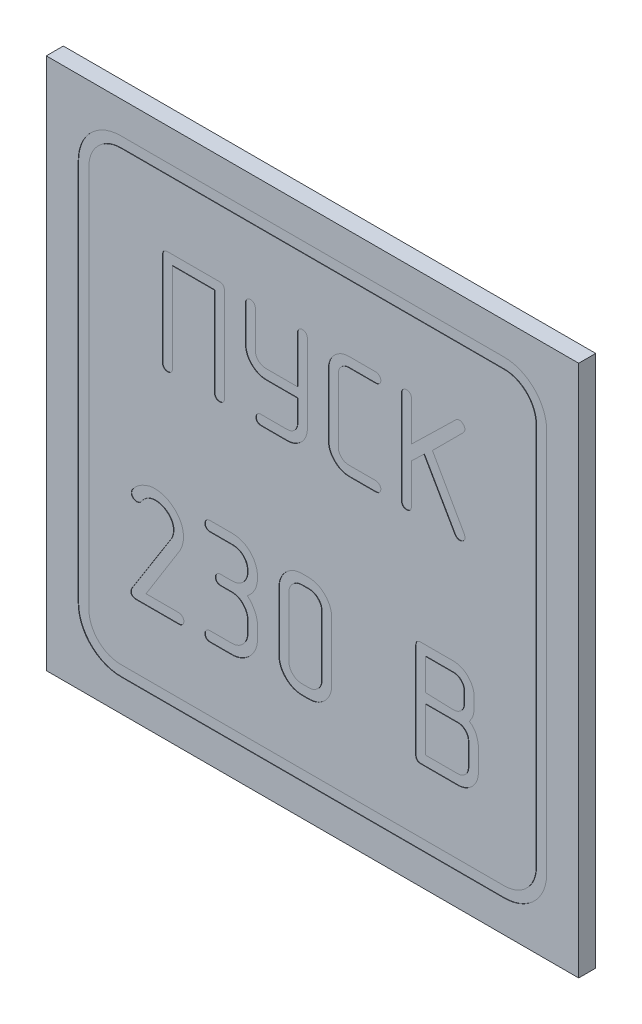
from build123d import *

# Parameters (mm, degrees)
SKETCH_1_W                 = 25
SKETCH_1_H                 = 25
EXTRUDE_1_DEPTH            = 0.8
CUT_EXTRUDE_1_DEPTH        = 0.02
CUT_EXTRUDE_1_2_DEPTH      = 0.02
CUT_EXTRUDE_1_2_DEPTH_BACK = 0.02


with BuildPart() as part:
    # Эскиз1 → Вытянуть1 (new body)
    with BuildSketch(Plane.XY):
        with Locations((12.5, 12.5)):
            Rectangle(SKETCH_1_W, SKETCH_1_H)
    extrude(amount=EXTRUDE_1_DEPTH)

    # Эскиз2 → Cut-Extrude 1 (cut)
    # profile 1 of 8: a face of its own
    with BuildSketch(Plane.XY.offset(0.8)):
        with BuildLine():
            add(Edge.make_bspline(
                [(8.365795812, 15.244391424), (8.365072341, 15.226090597), (8.3636754, 15.190753788), (8.351056124, 15.140751757), (8.330695909, 15.095952852), (8.310030336, 15.071777107), (8.299799816, 15.059808872)],
                knots=[0, 0, 0, 0, 1.091649492, 2.107850678, 3.063288918, 4, 4, 4, 4], degree=3))
            add(Edge.make_bspline(
                [(8.299799816, 15.059808872), (8.288784641, 15.050728173), (8.26682198, 15.032622576), (8.227036995, 15.013721489), (8.182524717, 15.002435695), (8.151034119, 15.000828199), (8.134809825, 15)],
                knots=[0, 0, 0, 0, 0.951182289, 1.896519658, 2.916264364, 4, 4, 4, 4], degree=3))
            add(Edge.make_bspline(
                [(8.134809825, 15), (8.11959959, 15.000786555), (8.090107441, 15.002311658), (8.047588298, 15.014478485), (8.00782008, 15.033025544), (7.971464218, 15.059807151), (7.941137701, 15.095253577), (7.919389365, 15.13876654), (7.905452492, 15.189582778), (7.904388213, 15.22607252), (7.903823838, 15.245422611)],
                knots=[0, 0, 0, 0, 0.960624492, 1.862619603, 2.776848362, 3.724840655, 4.696474829, 5.698056661, 6.779305879, 8, 8, 8, 8], degree=3))
            Line((7.903823838, 15.245422611), (7.903823838, 19.421731753))
            Line((7.903823838, 19.421731753), (5.923943948, 19.421731753))
            Line((5.923943948, 19.421731753), (5.923943948, 15.245422611))
            add(Edge.make_bspline(
                [(5.923943948, 15.245422611), (5.923216357, 15.2271249), (5.921811461, 15.191794106), (5.909247595, 15.141750177), (5.888578086, 15.096847872), (5.868149321, 15.072144714), (5.857947952, 15.059808872)],
                knots=[0, 0, 0, 0, 1.08722023, 2.099298278, 3.050859919, 4, 4, 4, 4], degree=3))
            add(Edge.make_bspline(
                [(5.857947952, 15.059808872), (5.846932778, 15.050728173), (5.824970116, 15.032622576), (5.785185131, 15.013721489), (5.740672854, 15.002435695), (5.709182255, 15.000828199), (5.692957961, 15)],
                knots=[0, 0, 0, 0, 0.951182289, 1.896519658, 2.916264364, 4, 4, 4, 4], degree=3))
            add(Edge.make_bspline(
                [(5.692957961, 15), (5.677746708, 15.000785682), (5.648252583, 15.002309093), (5.605747628, 15.014488075), (5.565924848, 15.032988387), (5.529992317, 15.059796655), (5.498957884, 15.094276289), (5.477599734, 15.137788547), (5.463582149, 15.188535795), (5.462529945, 15.225035859), (5.461971974, 15.244391424)],
                knots=[0, 0, 0, 0, 0.962602444, 1.866454789, 2.78256597, 3.732510206, 4.689672778, 5.693316895, 6.776792436, 8, 8, 8, 8], degree=3))
            Line((5.461971974, 15.244391424), (5.461971974, 19.639312304))
            add(Edge.make_bspline(
                [(5.461971974, 19.639312304), (5.4627342, 19.658623225), (5.464164995, 19.694872288), (5.475363616, 19.745279174), (5.494288385, 19.788359044), (5.521276856, 19.823974879), (5.556423668, 19.851668459), (5.599399936, 19.870259857), (5.649424763, 19.881449447), (5.685332337, 19.882924506), (5.704301023, 19.883703727)],
                knots=[0, 0, 0, 0, 1.174787525, 2.205226063, 3.123069814, 4.018700482, 4.897801082, 5.815644833, 6.846083372, 8, 8, 8, 8], degree=3))
            Line((5.704301023, 19.883703727), (8.123466763, 19.883703727))
            add(Edge.make_bspline(
                [(8.123466763, 19.883703727), (8.142435449, 19.882924506), (8.178343023, 19.881449447), (8.22836785, 19.870259857), (8.271344118, 19.851668459), (8.30649093, 19.823974879), (8.333479402, 19.788359044), (8.35240417, 19.745279174), (8.363602791, 19.694872288), (8.365033586, 19.658623225), (8.365795812, 19.639312304)],
                knots=[0, 0, 0, 0, 1.153916628, 2.184355167, 3.102198918, 3.981299518, 4.876930186, 5.794773937, 6.825212475, 8, 8, 8, 8], degree=3))
            Line((8.365795812, 19.639312304), (8.365795812, 15.244391424))
        make_face()
    # profile 2 of 8: a face of its own
    with BuildSketch(Plane.XY.offset(0.8)):
        with BuildLine():
            Line((11.797587621, 16.979879889), (10.332270265, 16.979879889))
            add(Edge.make_bspline(
                [(10.332270265, 16.979879889), (10.299561949, 16.980536984), (10.235232436, 16.981829335), (10.140712119, 16.996106711), (10.049359977, 17.017357149), (9.961236333, 17.048593294), (9.87668915, 17.088885209), (9.79577052, 17.137913299), (9.717844992, 17.194869915), (9.644585923, 17.260396467), (9.576833048, 17.331764213), (9.517529717, 17.408364815), (9.468325093, 17.489344358), (9.425984585, 17.572940189), (9.395458231, 17.661634457), (9.372863727, 17.753773675), (9.35750013, 17.849692224), (9.356328064, 17.915107241), (9.355735757, 17.948164898)],
                knots=[0, 0, 0, 0, 1.026333242, 2.018554473, 2.995093272, 3.968046237, 4.948157751, 5.931118087, 6.935012911, 7.974823293, 9.013288221, 10.021525797, 11.010100225, 11.985206272, 12.958159238, 13.947734932, 14.962882269, 16, 16, 16, 16], degree=3))
            Line((9.355735757, 17.948164898), (9.355735757, 19.641374678))
            add(Edge.make_bspline(
                [(9.355735757, 19.641374678), (9.356446916, 19.657289295), (9.357879499, 19.689348272), (9.372286892, 19.736000625), (9.393880118, 19.781164952), (9.414345703, 19.808060395), (9.424825316, 19.821832481)],
                knots=[0, 0, 0, 0, 0.966544804, 1.947042782, 2.94876229, 4, 4, 4, 4], degree=3))
            add(Edge.make_bspline(
                [(9.424825316, 19.821832481), (9.436551063, 19.831222703), (9.459702648, 19.849762975), (9.499293033, 19.869382361), (9.542035733, 19.881339108), (9.57151708, 19.882899152), (9.586721744, 19.883703727)],
                knots=[0, 0, 0, 0, 1.015427485, 2.004883423, 2.971041728, 4, 4, 4, 4], degree=3))
            add(Edge.make_bspline(
                [(9.586721744, 19.883703727), (9.601229667, 19.882846225), (9.630003048, 19.881145552), (9.671670288, 19.869500591), (9.711001724, 19.85012768), (9.747620356, 19.824028887), (9.779570148, 19.789488257), (9.802297619, 19.746195792), (9.81602051, 19.695130811), (9.817123061, 19.658655005), (9.817707731, 19.639312304)],
                knots=[0, 0, 0, 0, 0.921612733, 1.827822837, 2.726630868, 3.696675955, 4.670893298, 5.687299756, 6.773601616, 8, 8, 8, 8], degree=3))
            Line((9.817707731, 19.639312304), (9.817707731, 17.930634711))
            add(Edge.make_bspline(
                [(9.817707731, 17.930634711), (9.81957956, 17.897465328), (9.823246025, 17.832494456), (9.849583401, 17.738906707), (9.894445397, 17.653195085), (9.937255124, 17.605345239), (9.958980411, 17.581062168)],
                knots=[0, 0, 0, 0, 1.028312002, 2.014216694, 2.992245141, 4, 4, 4, 4], degree=3))
            add(Edge.make_bspline(
                [(9.958980411, 17.581062168), (9.984208148, 17.560970098), (10.033940572, 17.521361814), (10.090107911, 17.491584453), (10.117783277, 17.476912237)],
                knots=[0, 0, 0, 0, 1.01453881, 2, 2, 2, 2], degree=3))
            add(Edge.make_bspline(
                [(10.117783277, 17.476912237), (10.151575415, 17.46696657), (10.215301227, 17.448210855), (10.281556076, 17.443884204), (10.312677703, 17.441851864)],
                knots=[0, 0, 0, 0, 1.06054792, 2, 2, 2, 2], degree=3))
            Line((10.312677703, 17.441851864), (11.797587621, 17.441851864))
            Line((11.797587621, 17.441851864), (11.797587621, 19.639312304))
            add(Edge.make_bspline(
                [(11.797587621, 19.639312304), (11.798269717, 19.65557461), (11.799629141, 19.687985538), (11.814138843, 19.734969869), (11.835731958, 19.78013365), (11.856197559, 19.807029168), (11.866677179, 19.820801293)],
                knots=[0, 0, 0, 0, 0.982279067, 1.957691288, 2.954214966, 4, 4, 4, 4], degree=3))
            add(Edge.make_bspline(
                [(11.866677179, 19.820801293), (11.878351303, 19.83060446), (11.901245628, 19.849829618), (11.941175864, 19.869341734), (11.983879347, 19.88134993), (12.013366137, 19.882902835), (12.028573608, 19.883703727)],
                knots=[0, 0, 0, 0, 1.025879868, 2.011870596, 2.974645281, 4, 4, 4, 4], degree=3))
            add(Edge.make_bspline(
                [(12.028573608, 19.883703727), (12.043081531, 19.882846225), (12.071854912, 19.881145552), (12.113522151, 19.869500591), (12.152853588, 19.85012768), (12.189472219, 19.824028887), (12.221422012, 19.789488257), (12.244149483, 19.746195792), (12.257872374, 19.695130811), (12.258974925, 19.658655005), (12.259559595, 19.639312304)],
                knots=[0, 0, 0, 0, 0.921612733, 1.827822837, 2.726630868, 3.696675955, 4.670893298, 5.687299756, 6.773601616, 8, 8, 8, 8], degree=3))
            Line((12.259559595, 19.639312304), (12.259559595, 15.976534508))
            add(Edge.make_bspline(
                [(12.259559595, 15.976534508), (12.258866121, 15.943491165), (12.257502049, 15.878494431), (12.243777212, 15.783081777), (12.220797065, 15.691687544), (12.189648367, 15.60369989), (12.150610941, 15.518174862), (12.100664119, 15.437117659), (12.042734514, 15.359416428), (11.977012, 15.28670978), (11.905296766, 15.22004835), (11.828995818, 15.16084003), (11.748348184, 15.111217203), (11.664179404, 15.071010319), (11.576769563, 15.038172672), (11.485002519, 15.016026359), (11.389670148, 15.002056061), (11.325009378, 15.000690608), (11.292305774, 15)],
                knots=[0, 0, 0, 0, 1.037699588, 2.041170104, 3.02081998, 3.994318803, 4.970390255, 5.968733261, 6.979615547, 8.011962211, 9.04363074, 10.05243397, 11.041563021, 12.012482399, 12.979489555, 13.969620435, 14.973090951, 16, 16, 16, 16], degree=3))
            Line((11.292305774, 15), (10.083754091, 15))
            add(Edge.make_bspline(
                [(10.083754091, 15), (10.066135917, 15.00071367), (10.032145308, 15.002090547), (9.983880657, 15.014900494), (9.940279773, 15.035385523), (9.916310615, 15.055793323), (9.904327476, 15.065995996)],
                knots=[0, 0, 0, 0, 1.077429077, 2.078675667, 3.03945327, 4, 4, 4, 4], degree=3))
            add(Edge.make_bspline(
                [(9.904327476, 15.065995996), (9.894901818, 15.077703459), (9.876097724, 15.101059731), (9.856799424, 15.141554301), (9.844815823, 15.185278527), (9.843258914, 15.215437264), (9.84245623, 15.230985987)],
                knots=[0, 0, 0, 0, 0.998808508, 1.992613065, 2.965065947, 4, 4, 4, 4], degree=3))
            add(Edge.make_bspline(
                [(9.84245623, 15.230985987), (9.843192511, 15.244850202), (9.844658667, 15.272457997), (9.85853213, 15.312623366), (9.877712528, 15.352111969), (9.905972226, 15.389186574), (9.940726212, 15.422127061), (9.984195967, 15.445294946), (10.03324552, 15.460450605), (10.068507554, 15.461451434), (10.086847654, 15.461971974)],
                knots=[0, 0, 0, 0, 0.886426588, 1.765140182, 2.701969987, 3.694250836, 4.73997423, 5.746606742, 6.827989987, 8, 8, 8, 8], degree=3))
            Line((10.086847654, 15.461971974), (11.308804773, 15.461971974))
            add(Edge.make_bspline(
                [(11.308804773, 15.461971974), (11.341265925, 15.463891509), (11.405174953, 15.46767066), (11.49769862, 15.493617479), (11.581382591, 15.539683269), (11.657068822, 15.60028657), (11.719645384, 15.675905931), (11.765156106, 15.764133002), (11.792530282, 15.862867149), (11.795864091, 15.932358838), (11.797587621, 15.968285008)],
                knots=[0, 0, 0, 0, 0.991527422, 1.952104304, 2.905769643, 3.891330169, 4.898304592, 5.879829594, 6.903903422, 8, 8, 8, 8], degree=3))
            Line((11.797587621, 15.968285008), (11.797587621, 16.979879889))
        make_face()
    # profile 3 of 8: a face of its own
    with BuildSketch(Plane.XY.offset(0.8)):
        with BuildLine():
            Line((15.464490166, 15), (14.234283547, 15))
            add(Edge.make_bspline(
                [(14.234283547, 15), (14.201237536, 15.000683596), (14.136235555, 15.00202824), (14.040530052, 15.015942107), (13.948680924, 15.038530568), (13.860203535, 15.070196072), (13.774040392, 15.108607842), (13.692678058, 15.159213945), (13.614103248, 15.21679099), (13.540021206, 15.282559282), (13.472724995, 15.355354312), (13.412546214, 15.432146753), (13.362772219, 15.513779806), (13.321089443, 15.598478285), (13.288891997, 15.687718395), (13.266845395, 15.780831044), (13.251167938, 15.877358284), (13.250061528, 15.943127693), (13.24949954, 15.976534508)],
                knots=[0, 0, 0, 0, 1.028286897, 2.022655204, 3.003804875, 3.968473356, 4.945411562, 5.93469887, 6.945007337, 7.975963957, 9.013399247, 10.028062878, 11.008219808, 11.984630304, 12.962974347, 13.954516674, 14.96102025, 16, 16, 16, 16], degree=3))
            Line((13.24949954, 15.976534508), (13.24949954, 18.907169219))
            add(Edge.make_bspline(
                [(13.24949954, 18.907169219), (13.250179576, 18.940559319), (13.251517387, 19.006246411), (13.265485787, 19.102965021), (13.287891433, 19.195999697), (13.320214242, 19.284985703), (13.360670076, 19.36987849), (13.409119769, 19.451410727), (13.468878821, 19.527419842), (13.535156211, 19.60007488), (13.607705928, 19.667147365), (13.686186658, 19.724727128), (13.768244144, 19.773299316), (13.853410452, 19.814560279), (13.943350923, 19.844785131), (14.036706923, 19.867964149), (14.13419534, 19.881632444), (14.200555508, 19.88300574), (14.234283547, 19.883703727)],
                knots=[0, 0, 0, 0, 1.037183757, 2.040412751, 3.030241086, 4.006893952, 4.976980221, 5.949886173, 6.947810811, 7.976208698, 9.004606584, 10.01316862, 10.99524074, 11.965327009, 12.948502614, 13.93833095, 14.952141686, 16, 16, 16, 16], degree=3))
            Line((14.234283547, 19.883703727), (15.464490166, 19.883703727))
            add(Edge.make_bspline(
                [(15.464490166, 19.883703727), (15.481082217, 19.883034059), (15.513478818, 19.881726506), (15.560020086, 19.867802869), (15.601923526, 19.844211148), (15.639782773, 19.813663625), (15.670823712, 19.777397332), (15.69476922, 19.738351161), (15.708787889, 19.696278631), (15.710224531, 19.667253031), (15.710943965, 19.65271774)],
                knots=[0, 0, 0, 0, 1.064052253, 2.077601868, 3.0860831, 4.13837496, 5.187880517, 6.138828305, 7.06797199, 8, 8, 8, 8], degree=3))
            add(Edge.make_bspline(
                [(15.710943965, 19.65271774), (15.707639367, 19.626012809), (15.700581538, 19.568977474), (15.659047944, 19.506049924), (15.614241121, 19.462293952), (15.570320217, 19.437692948), (15.518138898, 19.424808119), (15.481057919, 19.42279772), (15.461396604, 19.421731753)],
                knots=[0, 0, 0, 0, 1.266254501, 2.704416213, 3.467614585, 4.236046379, 5.064705186, 6, 6, 6, 6], degree=3))
            Line((15.461396604, 19.421731753), (14.211597423, 19.421731753))
            add(Edge.make_bspline(
                [(14.211597423, 19.421731753), (14.177751995, 19.419843524), (14.111450823, 19.416144597), (14.016032626, 19.390128457), (13.928926315, 19.344753627), (13.879813114, 19.302150793), (13.854806568, 19.280459074)],
                knots=[0, 0, 0, 0, 1.032059628, 2.021743112, 2.992747939, 4, 4, 4, 4], degree=3))
            add(Edge.make_bspline(
                [(13.854806568, 19.280459074), (13.832719915, 19.255849071), (13.7889979, 19.207131917), (13.74339419, 19.119957036), (13.717126774, 19.025211584), (13.713376444, 18.95992383), (13.711471514, 18.926761781)],
                knots=[0, 0, 0, 0, 1.010358544, 2.000072701, 2.984163436, 4, 4, 4, 4], degree=3))
            Line((13.711471514, 18.926761781), (13.711471514, 15.956941947))
            add(Edge.make_bspline(
                [(13.711471514, 15.956941947), (13.713227796, 15.923395643), (13.716672999, 15.857589672), (13.744705191, 15.763405264), (13.789058816, 15.676111121), (13.832635537, 15.627816212), (13.854806568, 15.603244654)],
                knots=[0, 0, 0, 0, 1.026550069, 2.013727771, 2.989421339, 4, 4, 4, 4], degree=3))
            add(Edge.make_bspline(
                [(13.854806568, 15.603244654), (13.880007687, 15.582780184), (13.929896351, 15.54226829), (13.986587063, 15.512007155), (14.014640622, 15.497032347)],
                knots=[0, 0, 0, 0, 1.010294363, 2, 2, 2, 2], degree=3))
            add(Edge.make_bspline(
                [(14.014640622, 15.497032347), (14.048778828, 15.48708625), (14.113202295, 15.468316602), (14.180133353, 15.464000813), (14.211597423, 15.461971974)],
                knots=[0, 0, 0, 0, 1.059806561, 2, 2, 2, 2], degree=3))
            Line((14.211597423, 15.461971974), (15.461396604, 15.461971974))
            add(Edge.make_bspline(
                [(15.461396604, 15.461971974), (15.477985951, 15.461276682), (15.510707871, 15.459905243), (15.557884395, 15.446044709), (15.600737696, 15.422800217), (15.638702369, 15.391887438), (15.669901521, 15.3557092), (15.693448385, 15.31640577), (15.709087598, 15.274761479), (15.710326099, 15.245556039), (15.710943965, 15.230985987)],
                knots=[0, 0, 0, 0, 1.057748023, 2.086371758, 3.108174774, 4.154232081, 5.197519594, 6.142833266, 7.073494011, 8, 8, 8, 8], degree=3))
            add(Edge.make_bspline(
                [(15.710943965, 15.230985987), (15.707597267, 15.204295252), (15.70047193, 15.147468943), (15.65990015, 15.08466974), (15.616235148, 15.04026629), (15.572338392, 15.016010416), (15.520549432, 15.003149978), (15.483809729, 15.001085569), (15.464490166, 15)],
                knots=[0, 0, 0, 0, 1.274021799, 2.712475087, 3.468462899, 4.24160831, 5.075350171, 6, 6, 6, 6], degree=3))
        make_face()
    # profile 4 of 8: a face of its own
    with BuildSketch(Plane.XY.offset(0.8)):
        with BuildLine():
            Line((17.143263322, 17.78214372), (19.235542643, 19.817707731))
            add(Edge.make_bspline(
                [(19.235542643, 19.817707731), (19.247909291, 19.827856107), (19.27219508, 19.847785623), (19.314435369, 19.86844714), (19.359206793, 19.881381958), (19.390133311, 19.882926741), (19.405688571, 19.883703727)],
                knots=[0, 0, 0, 0, 1.025751183, 2.014383971, 3.001285135, 4, 4, 4, 4], degree=3))
            add(Edge.make_bspline(
                [(19.405688571, 19.883703727), (19.420890978, 19.882520568), (19.451515152, 19.880137176), (19.496822072, 19.866543455), (19.539473356, 19.841894583), (19.578946749, 19.809225792), (19.613097849, 19.771084048), (19.640899067, 19.729068458), (19.654966983, 19.681759973), (19.657207568, 19.649352538), (19.658329494, 19.633125179)],
                knots=[0, 0, 0, 0, 0.934203003, 1.8818859, 2.873627656, 3.937884265, 5.01357923, 6.008680934, 7.002887762, 8, 8, 8, 8], degree=3))
            add(Edge.make_bspline(
                [(19.658329494, 19.633125179), (19.657545648, 19.621647279), (19.655828962, 19.596509765), (19.63895007, 19.558204917), (19.616567464, 19.514422169), (19.596181712, 19.485089687), (19.585115186, 19.469166376)],
                knots=[0, 0, 0, 0, 0.75327487, 1.649731969, 2.724143087, 4, 4, 4, 4], degree=3))
            Line((19.585115186, 19.469166376), (18.133203267, 18.018285644))
            Line((18.133203267, 18.018285644), (19.629456246, 15.366071542))
            Line((19.629456246, 15.366071542), (19.664516619, 15.237173112))
            add(Edge.make_bspline(
                [(19.664516619, 15.237173112), (19.663597544, 15.221881997), (19.661772374, 15.191515728), (19.644611017, 15.148342212), (19.620310712, 15.106684824), (19.595789865, 15.0846566), (19.583052811, 15.073214308)],
                knots=[0, 0, 0, 0, 0.966715818, 1.919778525, 2.919454473, 4, 4, 4, 4], degree=3))
            add(Edge.make_bspline(
                [(19.583052811, 15.073214308), (19.570425713, 15.061935002), (19.545590624, 15.039750762), (19.50081703, 15.017353784), (19.452808352, 15.001612872), (19.41888434, 15.000545147), (19.401563821, 15)],
                knots=[0, 0, 0, 0, 1.007531264, 1.981621398, 2.969480274, 4, 4, 4, 4], degree=3))
            add(Edge.make_bspline(
                [(19.401563821, 15), (19.38169973, 15.001585831), (19.342212846, 15.004738231), (19.286093855, 15.030967629), (19.234445769, 15.072250574), (19.20688361, 15.109237693), (19.19223277, 15.12889843)],
                knots=[0, 0, 0, 0, 0.927963832, 1.844655289, 2.854312906, 4, 4, 4, 4], degree=3))
            Line((19.19223277, 15.12889843), (17.736196102, 17.669744288))
            Line((17.736196102, 17.669744288), (17.143263322, 17.098466445))
            Line((17.143263322, 17.098466445), (17.143263322, 15.243360236))
            add(Edge.make_bspline(
                [(17.143263322, 15.243360236), (17.142574315, 15.225053402), (17.141256489, 15.190038933), (17.128363404, 15.140428601), (17.107912847, 15.095812929), (17.08747382, 15.071112276), (17.077267326, 15.058777684)],
                knots=[0, 0, 0, 0, 1.092637599, 2.089827516, 3.046130571, 4, 4, 4, 4], degree=3))
            add(Edge.make_bspline(
                [(17.077267326, 15.058777684), (17.066245697, 15.049723341), (17.044270167, 15.031670293), (17.004657924, 15.012402748), (16.95982404, 15.002784785), (16.928472132, 15.000948521), (16.912277335, 15)],
                knots=[0, 0, 0, 0, 0.952479984, 1.899107072, 2.914785828, 4, 4, 4, 4], degree=3))
            add(Edge.make_bspline(
                [(16.912277335, 15), (16.8970671, 15.000786555), (16.86757495, 15.002311658), (16.825055811, 15.014478486), (16.785287579, 15.033025539), (16.748931771, 15.05980717), (16.718605047, 15.095253501), (16.696857528, 15.13876684), (16.683008718, 15.189247914), (16.68188318, 15.225388129), (16.681291348, 15.244391424)],
                knots=[0, 0, 0, 0, 0.963235638, 1.86768253, 2.784396324, 3.734965427, 4.709240672, 5.71354498, 6.797733224, 8, 8, 8, 8], degree=3))
            Line((16.681291348, 15.244391424), (16.681291348, 19.646530616))
            add(Edge.make_bspline(
                [(16.681291348, 19.646530616), (16.682021475, 19.661743202), (16.683478167, 19.692094157), (16.697195756, 19.735980556), (16.7211137, 19.775938771), (16.751637234, 19.8126162), (16.787572849, 19.843607602), (16.826650111, 19.867522977), (16.868714905, 19.881549144), (16.897741531, 19.882984791), (16.912277335, 19.883703727)],
                knots=[0, 0, 0, 0, 0.999236149, 1.99359732, 2.986671625, 4.046521611, 5.120990907, 6.094558121, 7.045802594, 8, 8, 8, 8], degree=3))
            add(Edge.make_bspline(
                [(16.912277335, 19.883703727), (16.941238025, 19.881506792), (17.000014386, 19.877048062), (17.049215406, 19.844520145), (17.074173764, 19.828019606)],
                knots=[0, 0, 0, 0, 0.985453645, 2, 2, 2, 2], degree=3))
            add(Edge.make_bspline(
                [(17.074173764, 19.828019606), (17.084801401, 19.817157474), (17.106572772, 19.794905726), (17.127339151, 19.751261271), (17.14163185, 19.701749616), (17.142700859, 19.666243498), (17.143263322, 19.647561803)],
                knots=[0, 0, 0, 0, 0.910929471, 1.866095324, 2.877237029, 4, 4, 4, 4], degree=3))
            Line((17.143263322, 19.647561803), (17.143263322, 17.78214372))
        make_face()
    # profile 5 of 8: a face of its own
    with BuildSketch(Plane.XY.offset(0.8)):
        with BuildLine():
            Line((6.284334785, 8.033085415), (4.685223591, 5.46823648))
            Line((4.685223591, 5.46823648), (6.216398688, 5.46823648))
            add(Edge.make_bspline(
                [(6.216398688, 5.46823648), (6.232866086, 5.467531742), (6.265350662, 5.466141534), (6.312152993, 5.452082689), (6.354511378, 5.42848183), (6.392067149, 5.397205866), (6.422354603, 5.36017419), (6.446704558, 5.320943293), (6.460863809, 5.278262275), (6.462326499, 5.248848113), (6.463058977, 5.23411824)],
                knots=[0, 0, 0, 0, 1.049035914, 2.069391155, 3.084643979, 4.126821057, 5.168998136, 6.1263312, 7.061713754, 8, 8, 8, 8], degree=3))
            add(Edge.make_bspline(
                [(6.463058977, 5.23411824), (6.459593046, 5.207110052), (6.452236685, 5.14978577), (6.412389181, 5.08560968), (6.368085333, 5.040814975), (6.32391131, 5.016448113), (6.272204147, 5.003144376), (6.235638929, 5.001084098), (6.216398688, 5)],
                knots=[0, 0, 0, 0, 1.282713716, 2.722531535, 3.483677017, 4.262097154, 5.085533406, 6, 6, 6, 6], degree=3))
            Line((6.216398688, 5), (4.241026037, 5))
            add(Edge.make_bspline(
                [(4.241026037, 5), (4.220077735, 5.000501831), (4.180727307, 5.001444498), (4.12551136, 5.010952708), (4.078138131, 5.025866498), (4.039039103, 5.048183779), (4.009038656, 5.077040971), (3.986987147, 5.112011517), (3.974514332, 5.153870811), (3.973139527, 5.183866812), (3.972417163, 5.199627607)],
                knots=[0, 0, 0, 0, 1.318247643, 2.476267915, 3.517133912, 4.431675526, 5.285213851, 6.113267656, 7.008654443, 8, 8, 8, 8], degree=3))
            add(Edge.make_bspline(
                [(3.972417163, 5.199627607), (3.973365189, 5.213286092), (3.975363094, 5.242070478), (3.988040796, 5.286546829), (4.006921595, 5.334848362), (4.023980605, 5.367361774), (4.033037065, 5.384622823)],
                knots=[0, 0, 0, 0, 0.834498753, 1.75865294, 2.810090946, 4, 4, 4, 4], degree=3))
            Line((4.033037065, 5.384622823), (5.881944059, 8.315281508))
            add(Edge.make_bspline(
                [(5.881944059, 8.315281508), (5.896221073, 8.347062758), (5.92410148, 8.409125751), (5.953252425, 8.504151753), (5.970665697, 8.597191451), (5.973549095, 8.658377589), (5.974964253, 8.688407453)],
                knots=[0, 0, 0, 0, 1.077976984, 2.105092662, 3.069988531, 4, 4, 4, 4], degree=3))
            add(Edge.make_bspline(
                [(5.974964253, 8.688407453), (5.974068697, 8.714571011), (5.972292878, 8.766451374), (5.960916738, 8.84299721), (5.940456006, 8.916681398), (5.913679977, 8.988175047), (5.877600976, 9.056197217), (5.834317647, 9.121740608), (5.782905151, 9.184515855), (5.743976327, 9.223507844), (5.724123281, 9.243393103)],
                knots=[0, 0, 0, 0, 1.001356293, 1.985614019, 2.952654674, 3.923273066, 4.901280323, 5.892287325, 6.925101988, 8, 8, 8, 8], degree=3))
            add(Edge.make_bspline(
                [(5.724123281, 9.243393103), (5.682810017, 9.277863137), (5.599028341, 9.347767013), (5.47483565, 9.409147029), (5.368867799, 9.446387036), (5.28539133, 9.467744262), (5.198367889, 9.479074558), (5.139554552, 9.480808042), (5.109562901, 9.481692026)],
                knots=[0, 0, 0, 0, 1.432193878, 2.904432902, 3.663213759, 4.430043462, 5.199406286, 6, 6, 6, 6], degree=3))
            add(Edge.make_bspline(
                [(5.109562901, 9.481692026), (5.078099356, 9.480531575), (5.015304027, 9.478215534), (4.922799297, 9.458017737), (4.83120661, 9.428355895), (4.774017382, 9.397940572), (4.744798321, 9.382400808)],
                knots=[0, 0, 0, 0, 0.986895246, 1.969657644, 2.962659636, 4, 4, 4, 4], degree=3))
            add(Edge.make_bspline(
                [(4.744798321, 9.382400808), (4.716431513, 9.363540942), (4.659863475, 9.325931297), (4.583991712, 9.257985258), (4.513637183, 9.184117929), (4.474807259, 9.128277662), (4.455286033, 9.100204715)],
                knots=[0, 0, 0, 0, 1.002390868, 1.998930695, 2.993989149, 4, 4, 4, 4], degree=3))
            add(Edge.make_bspline(
                [(4.455286033, 9.100204715), (4.443082766, 9.084480539), (4.415949098, 9.049518218), (4.378623631, 9.025581591), (4.358085157, 9.012410375)],
                knots=[0, 0, 0, 0, 0.899492679, 2, 2, 2, 2], degree=3))
            Line((4.358085157, 9.012410375), (4.247297061, 8.987326277))
            add(Edge.make_bspline(
                [(4.247297061, 8.987326277), (4.231491996, 8.987986236), (4.199971172, 8.989302423), (4.154482941, 9.004571226), (4.109806139, 9.024673429), (4.069932554, 9.055598215), (4.034254968, 9.090802656), (4.00842002, 9.132661585), (3.993243916, 9.178968926), (3.991219592, 9.21122907), (3.990185065, 9.227715542)],
                knots=[0, 0, 0, 0, 0.970789839, 1.936094272, 2.935708313, 3.980052531, 5.028588703, 6.012606459, 6.984347121, 8, 8, 8, 8], degree=3))
            add(Edge.make_bspline(
                [(3.990185065, 9.227715542), (3.992860427, 9.247802772), (3.99941609, 9.297024194), (4.020536111, 9.342120849), (4.033037065, 9.368813588)],
                knots=[0, 0, 0, 0, 0.816198688, 2, 2, 2, 2], degree=3))
            add(Edge.make_bspline(
                [(4.033037065, 9.368813588), (4.062630235, 9.41044797), (4.122099651, 9.494114992), (4.231394509, 9.604496981), (4.353994484, 9.70429795), (4.445462673, 9.758392863), (4.491867008, 9.785836704)],
                knots=[0, 0, 0, 0, 0.97790503, 1.965164305, 2.967671729, 4, 4, 4, 4], degree=3))
            add(Edge.make_bspline(
                [(4.491867008, 9.785836704), (4.538735149, 9.810027281), (4.631005673, 9.857651898), (4.775678371, 9.907295095), (4.918567281, 9.944226177), (5.014580567, 9.948057047), (5.061485048, 9.949928506)],
                knots=[0, 0, 0, 0, 1.055887345, 2.078752778, 3.061430904, 4, 4, 4, 4], degree=3))
            add(Edge.make_bspline(
                [(5.061485048, 9.949928506), (5.108920323, 9.948681832), (5.202039751, 9.946234505), (5.339281919, 9.928130417), (5.470791154, 9.897817685), (5.597107755, 9.856190564), (5.717166805, 9.801264685), (5.83134645, 9.733902038), (5.940436424, 9.655101367), (6.04303303, 9.566003381), (6.136574237, 9.468494428), (6.218755871, 9.364686756), (6.2875242, 9.255811509), (6.345266515, 9.142804827), (6.388662947, 9.024750133), (6.420419142, 8.902274848), (6.439729262, 8.775075242), (6.442031804, 8.688474714), (6.443200733, 8.644510283)],
                knots=[0, 0, 0, 0, 1.07713943, 2.114515162, 3.137548884, 4.138402978, 5.129829663, 6.129964134, 7.144517493, 8.182134601, 9.211847614, 10.209098401, 11.183711391, 12.132050352, 13.08591865, 14.033960487, 15.001902051, 16, 16, 16, 16], degree=3))
            add(Edge.make_bspline(
                [(6.443200733, 8.644510283), (6.441540726, 8.593482227), (6.438180356, 8.490185586), (6.405544599, 8.336426867), (6.357345645, 8.181737207), (6.309044015, 8.083393977), (6.284334785, 8.033085415)],
                knots=[0, 0, 0, 0, 0.958992559, 1.941298943, 2.946848803, 4, 4, 4, 4], degree=3))
        make_face()
    # profile 6 of 8: a face of its own
    with BuildSketch(Plane.XY.offset(0.8)):
        with BuildLine():
            Line((8.714356697, 9.481692026), (7.700541103, 9.481692026))
            add(Edge.make_bspline(
                [(7.700541103, 9.481692026), (7.68199823, 9.482433499), (7.646194057, 9.4838652), (7.595431682, 9.496545433), (7.549805513, 9.517804439), (7.524240732, 9.538273732), (7.511365204, 9.548582951)],
                knots=[0, 0, 0, 0, 1.082783474, 2.090731409, 3.038409894, 4, 4, 4, 4], degree=3))
            add(Edge.make_bspline(
                [(7.511365204, 9.548582951), (7.501362349, 9.560388287), (7.481542658, 9.583779419), (7.462504944, 9.625383941), (7.448605117, 9.669282904), (7.447257345, 9.700014748), (7.44656462, 9.715810266)],
                knots=[0, 0, 0, 0, 1.007594706, 1.996451512, 2.970218466, 4, 4, 4, 4], degree=3))
            add(Edge.make_bspline(
                [(7.44656462, 9.715810266), (7.447310885, 9.729862485), (7.448796923, 9.757844651), (7.462858515, 9.798554677), (7.482299006, 9.83857876), (7.510941916, 9.87615611), (7.546167178, 9.909543281), (7.590226399, 9.933025331), (7.639941081, 9.948386506), (7.675681281, 9.949400907), (7.694270079, 9.949928506)],
                knots=[0, 0, 0, 0, 0.886426588, 1.765140182, 2.701969987, 3.694250836, 4.73997423, 5.746606742, 6.827989987, 8, 8, 8, 8], degree=3))
            Line((7.694270079, 9.949928506), (8.684046746, 9.949928506))
            add(Edge.make_bspline(
                [(8.684046746, 9.949928506), (8.731116684, 9.948554037), (8.82346451, 9.945857428), (8.958441325, 9.929758566), (9.085541501, 9.899724892), (9.20589355, 9.860701608), (9.318360296, 9.80749533), (9.424176839, 9.743993961), (9.522559059, 9.668299477), (9.580742458, 9.609549287), (9.610067999, 9.579938073)],
                knots=[0, 0, 0, 0, 1.10007907, 2.158275827, 3.169329497, 4.147569055, 5.10903335, 6.069566678, 7.027024855, 8, 8, 8, 8], degree=3))
            add(Edge.make_bspline(
                [(9.610067999, 9.579938073), (9.635110824, 9.550827249), (9.684564759, 9.493339934), (9.746824468, 9.398926958), (9.802253317, 9.301844392), (9.845745317, 9.199260829), (9.879588932, 9.092496638), (9.90344283, 8.981205908), (9.918355153, 8.865443289), (9.920464029, 8.78669814), (9.921528873, 8.746937013)],
                knots=[0, 0, 0, 0, 1.011347742, 1.997183856, 2.975805811, 3.955074047, 4.928163601, 5.924384392, 6.951950476, 8, 8, 8, 8], degree=3))
            add(Edge.make_bspline(
                [(9.921528873, 8.746937013), (9.920340144, 8.698742674), (9.918008651, 8.604217539), (9.893106155, 8.465742981), (9.857946447, 8.332572418), (9.804185377, 8.206118176), (9.737740033, 8.085077426), (9.653445226, 7.971588729), (9.555306575, 7.862966016), (9.479508234, 7.798490112), (9.440750344, 7.765521712)],
                knots=[0, 0, 0, 0, 1.020209835, 2.000970977, 2.973611179, 3.933444388, 4.905159373, 5.893119876, 6.922691094, 8, 8, 8, 8], degree=3))
            add(Edge.make_bspline(
                [(9.440750344, 7.765521712), (9.474249483, 7.736682954), (9.542213111, 7.678174391), (9.63137597, 7.574771288), (9.712281334, 7.459588549), (9.784890575, 7.334478573), (9.845913912, 7.20092551), (9.888694924, 7.06033512), (9.915851414, 6.915097547), (9.919622922, 6.816277656), (9.921528873, 6.766338508)],
                knots=[0, 0, 0, 0, 0.926315811, 1.879325348, 2.854774747, 3.876528351, 4.910341529, 5.927614713, 6.952709267, 8, 8, 8, 8], degree=3))
            Line((9.921528873, 6.766338508), (9.921528873, 6.261521053))
            add(Edge.make_bspline(
                [(9.921528873, 6.261521053), (9.920751633, 6.219291258), (9.919215605, 6.135834092), (9.900143453, 6.01316157), (9.872658432, 5.894616515), (9.832378299, 5.78086643), (9.78093281, 5.671606105), (9.717730291, 5.566709183), (9.643489817, 5.465981407), (9.557784886, 5.372203127), (9.466423226, 5.284326949), (9.36707031, 5.209306631), (9.264971817, 5.143613669), (9.15742878, 5.09130221), (9.045796254, 5.050096884), (8.929536168, 5.020694259), (8.808208497, 5.004004586), (8.72590339, 5.001350001), (8.684046746, 5)],
                knots=[0, 0, 0, 0, 1.032030617, 2.03956357, 3.029646226, 4.005320733, 4.985043468, 5.978859951, 6.99639837, 8.040288379, 9.083203961, 10.092249456, 11.080496654, 12.04854917, 13.011071955, 13.986634805, 14.976093788, 16, 16, 16, 16], degree=3))
            Line((8.684046746, 5), (7.694270079, 5))
            add(Edge.make_bspline(
                [(7.694270079, 5), (7.676444193, 5.000861453), (7.64179826, 5.00253575), (7.592361818, 5.013741705), (7.547743464, 5.034012645), (7.522850632, 5.053796554), (7.510320033, 5.063755414)],
                knots=[0, 0, 0, 0, 1.074611043, 2.088586395, 3.037829185, 4, 4, 4, 4], degree=3))
            add(Edge.make_bspline(
                [(7.510320033, 5.063755414), (7.500451433, 5.076690974), (7.481398756, 5.101664836), (7.460814098, 5.143713725), (7.449199609, 5.188201518), (7.447448047, 5.218723832), (7.44656462, 5.23411824)],
                knots=[0, 0, 0, 0, 1.049924066, 2.027021419, 3.004897233, 4, 4, 4, 4], degree=3))
            add(Edge.make_bspline(
                [(7.44656462, 5.23411824), (7.449936692, 5.261159207), (7.457078793, 5.31843239), (7.4983009, 5.38226543), (7.543838524, 5.425903942), (7.587706564, 5.452313873), (7.640649485, 5.464943309), (7.677845877, 5.467101563), (7.697405591, 5.46823648)],
                knots=[0, 0, 0, 0, 1.272750596, 2.69570531, 3.462819016, 4.243362811, 5.076272775, 6, 6, 6, 6], degree=3))
            Line((7.697405591, 5.46823648), (8.700769477, 5.46823648))
            add(Edge.make_bspline(
                [(8.700769477, 5.46823648), (8.726254606, 5.468642084), (8.776801203, 5.46944655), (8.850541536, 5.481782861), (8.921799501, 5.499236104), (8.98968648, 5.525048243), (9.056157174, 5.555435518), (9.117716971, 5.596566521), (9.177843038, 5.64219994), (9.252008262, 5.712852429), (9.332157323, 5.81209077), (9.40229384, 5.946239487), (9.446278103, 6.09226782), (9.450923201, 6.193970783), (9.453292392, 6.245843492)],
                knots=[0, 0, 0, 0, 0.762142209, 1.511614757, 2.232672098, 2.955462843, 3.683354291, 4.415419634, 5.166560015, 5.941375375, 7.477641641, 8.961410111, 10.450193738, 12, 12, 12, 12], degree=3))
            Line((9.453292392, 6.245843492), (9.453292392, 6.764248167))
            add(Edge.make_bspline(
                [(9.453292392, 6.764248167), (9.450762507, 6.815725708), (9.445790695, 6.916891056), (9.403942328, 7.062811686), (9.332723379, 7.195756022), (9.253639419, 7.29531619), (9.180272446, 7.366402794), (9.120651331, 7.413218913), (9.058078595, 7.453008928), (8.99184105, 7.485569805), (8.922465756, 7.510926073), (8.849813549, 7.528186103), (8.774361975, 7.540716519), (8.72277185, 7.541471838), (8.696588795, 7.541855179)],
                knots=[0, 0, 0, 0, 1.533728977, 3.01413434, 4.483223777, 6.007344777, 6.786470932, 7.526637132, 8.264757458, 8.994488945, 9.724368435, 10.46292764, 11.219904006, 12, 12, 12, 12], degree=3))
            Line((8.696588795, 7.541855179), (8.191771339, 7.541855179))
            add(Edge.make_bspline(
                [(8.191771339, 7.541855179), (8.173595191, 7.542712976), (8.138256831, 7.544380718), (8.087840209, 7.555644247), (8.042311038, 7.57556932), (8.017200776, 7.595618199), (8.004685781, 7.605610592)],
                knots=[0, 0, 0, 0, 1.079228925, 2.098254295, 3.052166909, 4, 4, 4, 4], degree=3))
            add(Edge.make_bspline(
                [(8.004685781, 7.605610592), (7.994784815, 7.61853727), (7.975669652, 7.643493982), (7.955489006, 7.685748169), (7.942195567, 7.729873856), (7.940658241, 7.760548619), (7.939885197, 7.775973419)],
                knots=[0, 0, 0, 0, 1.048365217, 2.024011849, 3.006374687, 4, 4, 4, 4], degree=3))
            add(Edge.make_bspline(
                [(7.939885197, 7.775973419), (7.943178095, 7.803072689), (7.950174768, 7.860652586), (7.992762448, 7.923758451), (8.038460383, 7.968470095), (8.083796696, 7.993623469), (8.137719343, 8.007092359), (8.175667719, 8.009046907), (8.195952022, 8.010091659)],
                knots=[0, 0, 0, 0, 1.258100478, 2.673182502, 3.431466272, 4.231225732, 5.054548406, 6, 6, 6, 6], degree=3))
            Line((8.195952022, 8.010091659), (8.707040502, 8.010091659))
            add(Edge.make_bspline(
                [(8.707040502, 8.010091659), (8.734932056, 8.011068987), (8.78951563, 8.012981611), (8.869597623, 8.022846245), (8.945188984, 8.042607409), (9.017941909, 8.06685738), (9.086282741, 8.101121588), (9.150831837, 8.141947644), (9.212737622, 8.188910047), (9.2488983, 8.226285032), (9.267252005, 8.24525507)],
                knots=[0, 0, 0, 0, 1.070147729, 2.094271507, 3.085807588, 4.061830826, 5.029773958, 6.008354147, 6.989120704, 8, 8, 8, 8], degree=3))
            add(Edge.make_bspline(
                [(9.267252005, 8.24525507), (9.295960773, 8.281539996), (9.352988415, 8.353617061), (9.411528215, 8.479884695), (9.447205189, 8.617103313), (9.451227658, 8.712567583), (9.453292392, 8.761569403)],
                knots=[0, 0, 0, 0, 0.987024596, 1.960644339, 2.953198527, 4, 4, 4, 4], degree=3))
            add(Edge.make_bspline(
                [(9.453292392, 8.761569403), (9.451035169, 8.809481856), (9.446662854, 8.902289856), (9.414238749, 9.035420875), (9.357118428, 9.155274727), (9.302786407, 9.223072613), (9.275613371, 9.256980322)],
                knots=[0, 0, 0, 0, 1.067567691, 2.067913768, 3.033707067, 4, 4, 4, 4], degree=3))
            add(Edge.make_bspline(
                [(9.275613371, 9.256980322), (9.258190526, 9.274767597), (9.22358559, 9.310096358), (9.165671784, 9.35646556), (9.102508512, 9.395465452), (9.033838111, 9.426678255), (8.960763316, 9.451897825), (8.882633584, 9.469601683), (8.800009182, 9.48020477), (8.743305315, 9.481189367), (8.714356697, 9.481692026)],
                knots=[0, 0, 0, 0, 0.95779418, 1.902353299, 2.8476737, 3.807718427, 4.800094425, 5.818320437, 6.886202787, 8, 8, 8, 8], degree=3))
        make_face()
    # profile 7 of 8: a face of its own
    with BuildSketch(Plane.XY.offset(0.8)):
        with BuildLine():
            add(Edge.make_bspline(
                [(13.399857012, 6.089067885), (13.39879044, 6.052789298), (13.396689511, 5.981327894), (13.381873107, 5.875845993), (13.356478321, 5.774111388), (13.322035947, 5.675696747), (13.278064618, 5.58087256), (13.222991889, 5.490404098), (13.158033046, 5.403814297), (13.08445809, 5.321711838), (13.003364651, 5.247167123), (12.917754555, 5.180700054), (12.827072653, 5.125239027), (12.732584477, 5.07845118), (12.633191302, 5.043270726), (12.529601038, 5.017785088), (12.42164607, 5.003198627), (12.348109553, 5.00107683), (12.310789127, 5)],
                knots=[0, 0, 0, 0, 1.017110807, 2.003500465, 2.9796304, 3.952823126, 4.923020576, 5.904755596, 6.916787402, 7.954379473, 8.991327563, 10.001471775, 10.98829668, 11.96691631, 12.95258013, 13.938195541, 14.953616171, 16, 16, 16, 16], degree=3))
            Line((12.310789127, 5), (12.013960644, 5))
            add(Edge.make_bspline(
                [(12.013960644, 5), (11.9776755, 5.001037213), (11.906201182, 5.003080312), (11.800894925, 5.018307191), (11.698886179, 5.042096421), (11.600295794, 5.076557766), (11.506314792, 5.122141117), (11.415299465, 5.175687954), (11.328370685, 5.239671935), (11.24702062, 5.313354588), (11.171691187, 5.393364981), (11.105685424, 5.479035062), (11.049806298, 5.569833329), (11.003633987, 5.664972458), (10.967928902, 5.764854762), (10.942837253, 5.86890491), (10.928011926, 5.977503482), (10.925946018, 6.051395578), (10.924892759, 6.089067885)],
                knots=[0, 0, 0, 0, 1.016353976, 2.002009663, 2.97511491, 3.947583485, 4.921227131, 5.897216674, 6.902684111, 7.939504111, 8.968529229, 9.977921794, 10.964012404, 11.950682612, 12.935613, 13.92997891, 14.944643966, 16, 16, 16, 16], degree=3))
            Line((10.924892759, 6.089067885), (10.924892759, 8.860860621))
            add(Edge.make_bspline(
                [(10.924892759, 8.860860621), (10.925991668, 8.896439807), (10.928177142, 8.967198488), (10.942775058, 9.071667098), (10.968124492, 9.172396622), (11.002938998, 9.26981396), (11.047927891, 9.363563542), (11.102693705, 9.454364109), (11.168077802, 9.540972755), (11.241309335, 9.623988777), (11.322470902, 9.699980457), (11.409001198, 9.766693483), (11.499422597, 9.823871804), (11.594053521, 9.870057528), (11.693149357, 9.906137952), (11.796711854, 9.930439144), (11.904030012, 9.947144585), (11.976966063, 9.948991643), (12.013960644, 9.949928506)],
                knots=[0, 0, 0, 0, 0.999358025, 1.987489389, 2.955846337, 3.912312608, 4.88840176, 5.871870267, 6.885689055, 7.932412047, 8.97785341, 10.003504867, 10.997241324, 11.97758894, 12.955785167, 13.952648631, 14.961543641, 16, 16, 16, 16], degree=3))
            Line((12.013960644, 9.949928506), (12.310789127, 9.949928506))
            add(Edge.make_bspline(
                [(12.310789127, 9.949928506), (12.347067251, 9.948860936), (12.418527744, 9.946758041), (12.524016298, 9.931955991), (12.625726061, 9.906507609), (12.723934609, 9.87236807), (12.818147689, 9.827835634), (12.908412027, 9.773089326), (12.995046694, 9.708144511), (13.077069941, 9.634178651), (13.152729136, 9.553800936), (13.219139495, 9.467790409), (13.274513171, 9.377117338), (13.321788011, 9.282901286), (13.354901196, 9.182862142), (13.382519841, 9.079880764), (13.396538128, 8.971685016), (13.398739696, 8.89817009), (13.399857012, 8.860860621)],
                knots=[0, 0, 0, 0, 1.01730614, 2.00388523, 2.980202626, 3.953582251, 4.915121034, 5.897044593, 6.909270755, 7.947062092, 8.990861153, 10.001199361, 10.988213781, 11.967021352, 12.949625216, 13.93779958, 14.953415217, 16, 16, 16, 16], degree=3))
            Line((13.399857012, 8.860860621), (13.399857012, 6.089067885))
        make_face()
        with BuildLine():
            Line((12.931620532, 6.070254812), (12.931620532, 8.879673694))
            add(Edge.make_bspline(
                [(12.931620532, 8.879673694), (12.92929263, 8.919586329), (12.924719949, 8.997986459), (12.891883494, 9.111684595), (12.83311185, 9.214297618), (12.756533689, 9.306972715), (12.662792434, 9.383856384), (12.557250357, 9.441927125), (12.439546511, 9.475103229), (12.358026623, 9.479451252), (12.31601498, 9.481692026)],
                knots=[0, 0, 0, 0, 1.000559683, 1.965392911, 2.935275591, 3.94645803, 4.964373359, 5.957237345, 6.947253024, 8, 8, 8, 8], degree=3))
            Line((12.31601498, 9.481692026), (12.00873479, 9.481692026))
            add(Edge.make_bspline(
                [(12.00873479, 9.481692026), (11.967698054, 9.480013166), (11.887296973, 9.476723866), (11.772226454, 9.440852742), (11.665241501, 9.386341206), (11.572063454, 9.308534278), (11.491735693, 9.217990817), (11.434634641, 9.113647138), (11.399404432, 8.999664483), (11.395256234, 8.920344927), (11.393129239, 8.879673694)],
                knots=[0, 0, 0, 0, 1.026138229, 2.01045768, 2.995397565, 4.020344428, 5.036424252, 6.01420537, 6.981780545, 8, 8, 8, 8], degree=3))
            Line((11.393129239, 8.879673694), (11.393129239, 6.070254812))
            add(Edge.make_bspline(
                [(11.393129239, 6.070254812), (11.395301109, 6.030283423), (11.399572701, 5.951668465), (11.434756276, 5.838590709), (11.490910706, 5.734060189), (11.569559544, 5.642034008), (11.663566973, 5.565067907), (11.769887599, 5.508205708), (11.886582042, 5.474957961), (11.96741413, 5.470510158), (12.00873479, 5.46823648)],
                knots=[0, 0, 0, 0, 1.000960555, 1.96866991, 2.94239886, 3.959596256, 4.984685255, 5.973824236, 6.964236563, 8, 8, 8, 8], degree=3))
            Line((12.00873479, 5.46823648), (12.31601498, 5.46823648))
            add(Edge.make_bspline(
                [(12.31601498, 5.46823648), (12.356684043, 5.469999845), (12.436265171, 5.473450393), (12.550670543, 5.50810313), (12.657014996, 5.561524968), (12.75117457, 5.637472148), (12.832016748, 5.72747364), (12.889228684, 5.832854392), (12.925606603, 5.948040549), (12.929583911, 6.028866873), (12.931620532, 6.070254812)],
                knots=[0, 0, 0, 0, 1.016426788, 1.988941573, 2.96891168, 3.981921139, 5.002724824, 5.979540199, 6.96540305, 8, 8, 8, 8], degree=3))
        make_face(mode=Mode.SUBTRACT)
    # profile 8 of 8: a face of its own
    with BuildSketch(Plane.XY.offset(0.8)):
        with BuildLine():
            add(Edge.make_bspline(
                [(19.863192713, 7.874219466), (19.897104136, 7.851563176), (19.964678864, 7.806416365), (20.051489357, 7.720216015), (20.126071774, 7.621980376), (20.184060178, 7.510939243), (20.231408413, 7.393314311), (20.264351306, 7.270082664), (20.286644361, 7.143408933), (20.288625674, 7.057340387), (20.289622365, 7.014043968)],
                knots=[0, 0, 0, 0, 0.974313857, 1.941498972, 2.912237091, 3.915945845, 4.93030387, 5.941881181, 6.964671993, 8, 8, 8, 8], degree=3))
            Line((20.289622365, 7.014043968), (20.289622365, 6.007544569))
            add(Edge.make_bspline(
                [(20.289622365, 6.007544569), (20.288904066, 5.973706878), (20.287483655, 5.906794032), (20.273633153, 5.808350898), (20.250308154, 5.713650252), (20.218999131, 5.622619975), (20.179178681, 5.534648818), (20.128640913, 5.45138795), (20.069556109, 5.371557081), (20.003233858, 5.295593838), (19.930252774, 5.226397326), (19.851998979, 5.166614355), (19.771366871, 5.114578574), (19.686127889, 5.072656292), (19.596790835, 5.039905132), (19.503433444, 5.017588161), (19.406989678, 5.00174279), (19.341370031, 5.000585083), (19.308207063, 5)],
                knots=[0, 0, 0, 0, 1.038553944, 2.05370399, 3.044839953, 4.029314396, 5.005852223, 6.003891933, 7.013786344, 8.052340288, 9.096663258, 10.095906219, 11.072268247, 12.038675251, 13.006561345, 13.987308911, 14.982822805, 16, 16, 16, 16], degree=3))
            Line((19.308207063, 5), (17.592036749, 5))
            add(Edge.make_bspline(
                [(17.592036749, 5), (17.572810841, 5.000789788), (17.536416348, 5.002284849), (17.485713166, 5.013626175), (17.442154124, 5.032469679), (17.406530709, 5.060538793), (17.379176264, 5.096637591), (17.359994869, 5.14030164), (17.34864439, 5.191392061), (17.347194193, 5.228132675), (17.346421631, 5.247705459)],
                knots=[0, 0, 0, 0, 1.153916628, 2.184355167, 3.102198918, 3.981299518, 4.876930186, 5.794773937, 6.825212475, 8, 8, 8, 8], degree=3))
            Line((17.346421631, 5.247705459), (17.346421631, 9.702223046))
            add(Edge.make_bspline(
                [(17.346421631, 9.702223046), (17.34723041, 9.721779186), (17.34874859, 9.758488556), (17.359683834, 9.809928173), (17.380438359, 9.853036764), (17.407507846, 9.88940078), (17.443430526, 9.917745442), (17.487867035, 9.936241194), (17.53955474, 9.947653552), (17.576641433, 9.949142548), (17.596217432, 9.949928506)],
                knots=[0, 0, 0, 0, 1.164715309, 2.18631923, 3.105001799, 3.992953645, 4.864517145, 5.793449026, 6.835284691, 8, 8, 8, 8], degree=3))
            Line((17.596217432, 9.949928506), (19.091856725, 9.949928506))
            add(Edge.make_bspline(
                [(19.091856725, 9.949928506), (19.126050586, 9.94925515), (19.193327262, 9.947930316), (19.29193663, 9.933601557), (19.386925718, 9.911926748), (19.477627224, 9.880605611), (19.564181954, 9.840194625), (19.647225713, 9.792253127), (19.72598378, 9.734333033), (19.799065657, 9.667749937), (19.866869799, 9.596090449), (19.927229857, 9.520183372), (19.975689796, 9.438472042), (20.018638717, 9.355428164), (20.049653371, 9.267309689), (20.072977673, 9.176113906), (20.086808651, 9.080770748), (20.088230435, 9.015938402), (20.088949587, 8.983145595)],
                knots=[0, 0, 0, 0, 1.061147515, 2.087815652, 3.08768346, 4.083327943, 5.061119066, 6.050158087, 7.05638581, 8.090551292, 9.116135753, 10.118166958, 11.094160779, 12.061844017, 13.01668066, 13.987564058, 14.982091062, 16, 16, 16, 16], degree=3))
            Line((20.088949587, 8.983145595), (20.088949587, 8.499231554))
            add(Edge.make_bspline(
                [(20.088949587, 8.499231554), (20.086272169, 8.44464549), (20.080914984, 8.33542549), (20.046315806, 8.202062419), (20.006575869, 8.09886599), (19.966733465, 8.02253533), (19.919344741, 7.946898705), (19.882074565, 7.898658809), (19.863192713, 7.874219466)],
                knots=[0, 0, 0, 0, 1.448258751, 2.897787606, 3.633103996, 4.382029969, 5.180302451, 6, 6, 6, 6], degree=3))
        make_face()
        with BuildLine():
            Line((17.814658112, 7.541855179), (17.814658112, 5.46823648))
            Line((17.814658112, 5.46823648), (19.319703941, 5.46823648))
            add(Edge.make_bspline(
                [(19.319703941, 5.46823648), (19.353352277, 5.46999437), (19.419022595, 5.473425183), (19.51324791, 5.501941584), (19.599487763, 5.547773272), (19.676418432, 5.610604006), (19.741940774, 5.687374449), (19.788181417, 5.77800354), (19.816389682, 5.879063224), (19.819678049, 5.949868143), (19.821385884, 5.986641155)],
                knots=[0, 0, 0, 0, 1.001355613, 1.954311872, 2.906702074, 3.896084438, 4.898677921, 5.892682449, 6.905550428, 8, 8, 8, 8], degree=3))
            Line((19.821385884, 5.986641155), (19.821385884, 7.023450504))
            add(Edge.make_bspline(
                [(19.821385884, 7.023450504), (19.820028873, 7.058484281), (19.817365622, 7.127241046), (19.789111245, 7.225169321), (19.744218253, 7.314941541), (19.681534926, 7.39296742), (19.606999245, 7.459575194), (19.520012496, 7.507774206), (19.42292052, 7.536893238), (19.354747385, 7.540170532), (19.319703941, 7.541855179)],
                knots=[0, 0, 0, 0, 1.041747408, 2.044517874, 3.010480817, 4.015989705, 5.009469057, 5.971685018, 6.957373109, 8, 8, 8, 8], degree=3))
            Line((19.319703941, 7.541855179), (17.814658112, 7.541855179))
        make_face(mode=Mode.SUBTRACT)
        with BuildLine():
            add(Edge.make_bspline(
                [(19.104398774, 7.963058977), (19.139097991, 7.964368077), (19.206860982, 7.966924577), (19.303590907, 7.995727082), (19.392399094, 8.040306612), (19.47112305, 8.101787091), (19.537824855, 8.177064669), (19.586579261, 8.265022059), (19.615829523, 8.363982159), (19.619049967, 8.433183709), (19.620713107, 8.468921603)],
                knots=[0, 0, 0, 0, 1.02919571, 2.009883367, 2.973785129, 3.970760785, 4.962120241, 5.945432109, 6.938955399, 8, 8, 8, 8], degree=3))
            Line((19.620713107, 8.468921603), (19.620713107, 8.9758294))
            add(Edge.make_bspline(
                [(19.620713107, 8.9758294), (19.618922902, 9.010155881), (19.615428572, 9.07715828), (19.587415408, 9.173493927), (19.540269891, 9.260667806), (19.476597629, 9.337551009), (19.399329371, 9.40186276), (19.310007501, 9.448566959), (19.210223513, 9.47657993), (19.140467491, 9.479949647), (19.104398774, 9.481692026)],
                knots=[0, 0, 0, 0, 1.020163205, 1.991272588, 2.955942624, 3.950072067, 4.94420151, 5.927189003, 6.92821248, 8, 8, 8, 8], degree=3))
            Line((19.104398774, 9.481692026), (17.814658112, 9.481692026))
            Line((17.814658112, 9.481692026), (17.814658112, 8.010091659))
            Line((17.814658112, 8.010091659), (19.104398774, 7.963058977))
        make_face(mode=Mode.SUBTRACT)
    extrude(amount=-CUT_EXTRUDE_1_DEPTH, mode=Mode.SUBTRACT)

    # Эскиз3 → Cut-Extrude 1 2 (cut, two sides: drawn at the far end of the back side and taken through both)
    with BuildSketch(Plane.XY.offset(0.8).offset(-CUT_EXTRUDE_1_2_DEPTH_BACK)):
        with BuildLine():
            Line((3.5, 1.5), (21.5, 1.5))
            ThreePointArc((21.5, 1.5), (22.914213562, 2.085786438), (23.5, 3.5))
            Line((23.5, 3.5), (23.5, 21.5))
            ThreePointArc((23.5, 21.5), (22.914213562, 22.914213562), (21.5, 23.5))
            Line((21.5, 23.5), (3.5, 23.5))
            ThreePointArc((3.5, 23.5), (2.085786438, 22.914213562), (1.5, 21.5))
            Line((1.5, 21.5), (1.5, 3.5))
            ThreePointArc((1.5, 3.5), (2.085786438, 2.085786438), (3.5, 1.5))
        make_face()
        with BuildLine():
            Line((3.5, 2), (21.5, 2))
            ThreePointArc((21.5, 2), (22.560660172, 2.439339828), (23, 3.5))
            Line((23, 3.5), (23, 21.5))
            ThreePointArc((23, 21.5), (22.560660172, 22.560660172), (21.5, 23))
            Line((21.5, 23), (3.5, 23))
            ThreePointArc((3.5, 23), (2.439339828, 22.560660172), (2, 21.5))
            Line((2, 21.5), (2, 3.5))
            ThreePointArc((2, 3.5), (2.439339828, 2.439339828), (3.5, 2))
        make_face(mode=Mode.SUBTRACT)
    extrude(amount=CUT_EXTRUDE_1_2_DEPTH + CUT_EXTRUDE_1_2_DEPTH_BACK, mode=Mode.SUBTRACT)


solid = part.part
